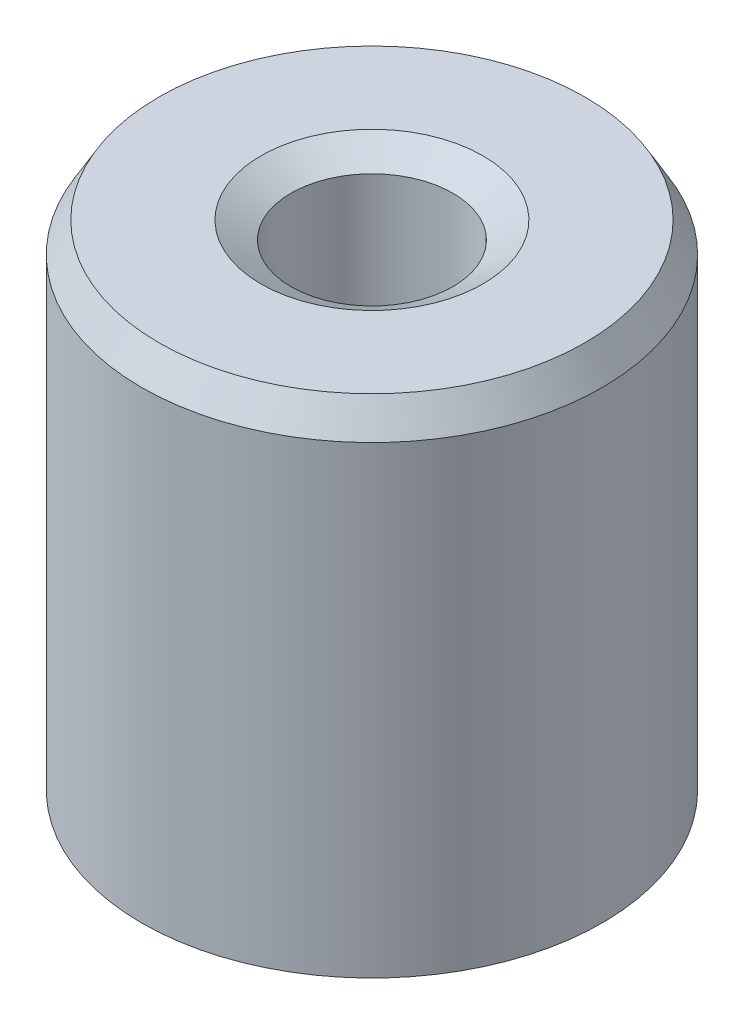
from build123d import *
from OCP.BRepFilletAPI import BRepFilletAPI_MakeChamfer

# Parameters (mm, degrees)
SKETCH1_R           = 10
BOSS_EXTRUDE1_DEPTH = 22.194162263
SKETCH2_R           = 3.516838065
CUT_EXTRUDE1_DEPTH  = 27.316930645
CHAMFER1_SIZE       = 1.304175663
CHAMFER1_SIZE2      = 0.75296617


with BuildPart() as part:
    # Sketch1 → Boss-Extrude1 (new body)
    with BuildSketch(Plane(origin=(0, 0, 0), x_dir=(1, 0, 0), z_dir=(0, 1, 0))):
        Circle(SKETCH1_R)
    extrude(amount=BOSS_EXTRUDE1_DEPTH)

    # Sketch2 → Cut-Extrude1 (cut, through all)
    with BuildSketch(Plane(origin=(0, 0, 0), x_dir=(1, 0, 0), z_dir=(0, 1, 0))):
        Circle(SKETCH2_R)
    extrude(amount=CUT_EXTRUDE1_DEPTH, mode=Mode.SUBTRACT)

    # Chamfer1: one chamfer whose edges measure the first distance from different faces: ONE call of the kernel's chamfer builder (chamfer() names one face for all edges)
    chamfer1_edges_1 = [part.edges().sort_by_distance(p)[0] for p in [
        (-3.516838065, 22.194162263, 0),
    ]]
    chamfer1_side_1 = [part.faces().sort_by_distance(p)[0] for p in [
        (-9.717157288, 22.194162263, 0),
    ]]
    chamfer1_edges_2 = [part.edges().sort_by_distance(p)[0] for p in [
        (-3.516838065, 0, 0),
    ]]
    chamfer1_side_2 = [part.faces().sort_by_distance(p)[0] for p in [
        (-3.516838065, 11.097081132, 0),
    ]]
    chamfer1_edges_3 = [part.edges().sort_by_distance(p)[0] for p in [
        (-10, 0, 0),
    ]]
    chamfer1_side_3 = [part.faces().sort_by_distance(p)[0] for p in [
        (-9.717157288, 0, 0),
    ]]
    chamfer1_edges_4 = [part.edges().sort_by_distance(p)[0] for p in [
        (-10, 22.194162263, 0),
    ]]
    chamfer1_side_4 = [part.faces().sort_by_distance(p)[0] for p in [
        (-10, 11.097081132, 0),
    ]]
    chamfer1 = BRepFilletAPI_MakeChamfer(part.part.solid().wrapped)
    for e in chamfer1_edges_1:
        chamfer1.Add(CHAMFER1_SIZE, CHAMFER1_SIZE2, e.wrapped, chamfer1_side_1[0].wrapped)  # the first distance lies on this face
    for e in chamfer1_edges_2:
        chamfer1.Add(CHAMFER1_SIZE, CHAMFER1_SIZE2, e.wrapped, chamfer1_side_2[0].wrapped)  # the first distance lies on this face
    for e in chamfer1_edges_3:
        chamfer1.Add(CHAMFER1_SIZE, CHAMFER1_SIZE2, e.wrapped, chamfer1_side_3[0].wrapped)  # the first distance lies on this face
    for e in chamfer1_edges_4:
        chamfer1.Add(CHAMFER1_SIZE, CHAMFER1_SIZE2, e.wrapped, chamfer1_side_4[0].wrapped)  # the first distance lies on this face
    add(Compound.cast(chamfer1.Shape()), mode=Mode.REPLACE)


solid = part.part
